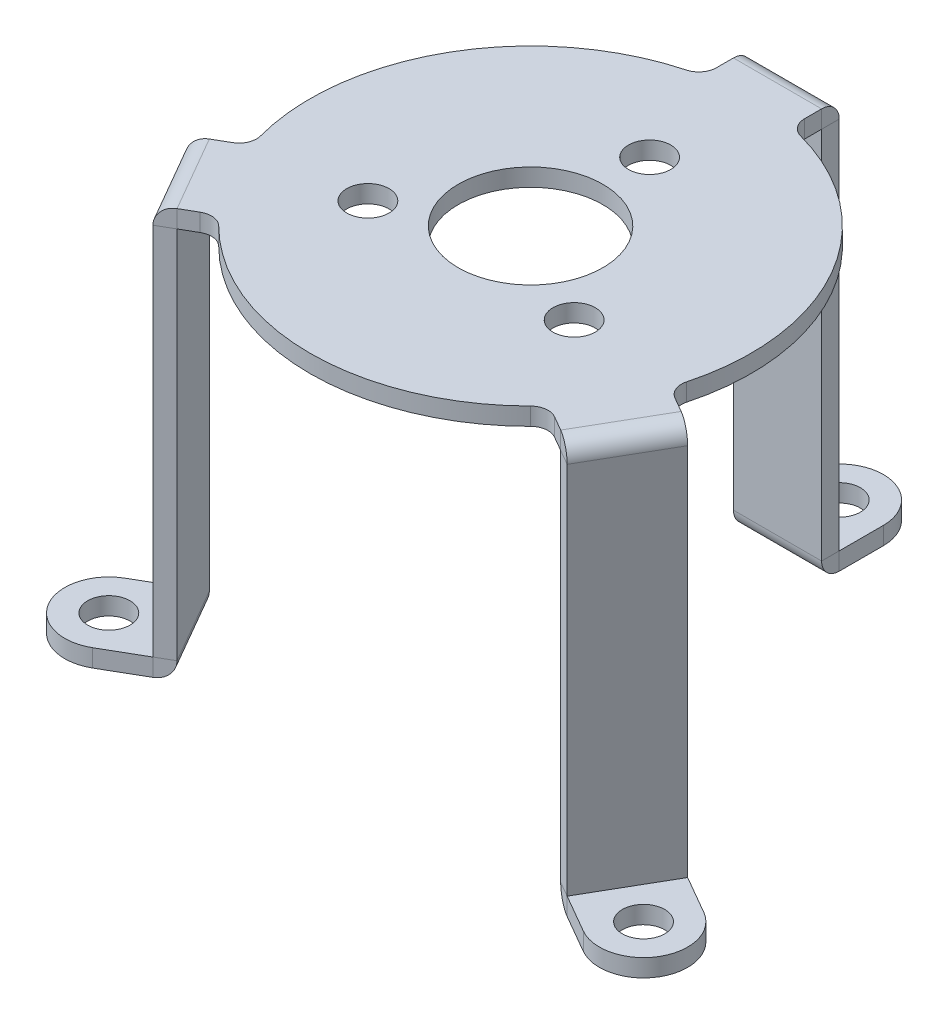
from build123d import *

# Parameters (mm, degrees)
ESBO_O1_R                  = 4.1
ESBO_O1_R_2                = 1.2
RESSALTO_EXTRUS_O1_DEPTH   = 1
ESBO_O2_W                  = 5
ESBO_O2_H                  = 1
RESSALTO_EXTRUS_O2_DEPTH   = 22.2
ESBO_O3_R                  = 1.2
RESSALTO_EXTRUS_O3_DEPTH   = 1
FILETE1_R                  = 1
CONVERT_SOLID4_OUTLINE_R   = 1.2
CONVERT_SOLID4_OUTLINE_R_2 = 4.1
CONVERT_SOLID4_DEPTH       = 1
CONVERT_SOLID4_START       = -21.2
CONVERT_SOLID4_2_OUTLINE_W = 5
CONVERT_SOLID4_2_OUTLINE_H = 1
CONVERT_SOLID4_2_DEPTH     = 21.2
CONVERT_SOLID4_START_2     = -2.5
CONVERT_SOLID4_3_DEPTH     = 5
CONVERT_SOLID4_4_DEPTH     = 4.999999999
CONVERT_SOLID4_5_DEPTH     = 5
CUT_EXTRUDE1_START         = -1
SKETCH18_R                 = 1.2
CUT_EXTRUDE1_DEPTH         = 1


with BuildPart() as part:
    # Esboço1 → Ressalto-extrusão1 (new body)
    with BuildSketch(Plane(origin=(0, 0, 0), x_dir=(1, 0, 0), z_dir=(0, 1, 0))):
        with BuildLine():
            Line((-2.5, 15), (-2.5, 12.247448714))
            ThreePointArc((-2.5, 12.247448714), (-10.825317547, 6.25), (-11.856601718, -3.958660847))
            Line((-11.856601718, -3.958660847), (-14.240381057, -5.334936491))
            Line((-14.240381057, -5.334936491), (-11.740381057, -9.665063509))
            Line((-11.740381057, -9.665063509), (-9.356601718, -8.288787866))
            ThreePointArc((-9.356601718, -8.288787866), (0, -12.5), (9.356601718, -8.288787866))
            Line((9.356601718, -8.288787866), (11.740381057, -9.665063509))
            Line((11.740381057, -9.665063509), (14.240381057, -5.334936491))
            Line((14.240381057, -5.334936491), (11.856601718, -3.958660847))
            ThreePointArc((11.856601718, -3.958660847), (10.825317547, 6.25), (2.5, 12.247448714))
            Line((2.5, 12.247448714), (2.5, 15))
            Line((2.5, 15), (-2.5, 15))
        make_face()
        with Locations(Location((0, 0, 0), (0, 0, 270))):
            Circle(ESBO_O1_R, mode=Mode.SUBTRACT)
        with Locations(Location((0, 6.75, 0), (0, 0, 270))):
            Circle(ESBO_O1_R_2, mode=Mode.SUBTRACT)
        with Locations(Location((5.845671476, -3.375, 0), (0, 0, 270))):
            Circle(ESBO_O1_R_2, mode=Mode.SUBTRACT)
        with Locations(Location((-5.845671476, -3.375, 0), (0, 0, 270))):
            Circle(ESBO_O1_R_2, mode=Mode.SUBTRACT)
    extrude(amount=RESSALTO_EXTRUS_O1_DEPTH)

    # Esboço2 → Ressalto-extrusão2 (add)
    with BuildSketch(Plane.XZ):
        with Locations((0, -14.5)):
            Rectangle(ESBO_O2_W, ESBO_O2_H)
        Polygon((-10.874355653, 9.165063509), (-11.740381057, 9.665063509), (-14.240381057, 5.334936491), (-13.374355653, 4.834936491), align=None)
        Polygon((13.374355653, 4.834936491), (14.240381057, 5.334936491), (11.740381057, 9.665063509), (10.874355653, 9.165063509), align=None)
    extrude(amount=RESSALTO_EXTRUS_O2_DEPTH)

    # Esboço3 → Ressalto-extrusão3 (add)
    # profile 1 of 3: a face of its own
    with BuildSketch(Plane.XZ.offset(22.2)):
        with BuildLine():
            Line((2.5, -15), (2.5, -17.5))
            ThreePointArc((2.5, -17.5), (0, -20), (-2.5, -17.5))
            Line((-2.5, -17.5), (-2.5, -15))
            Line((-2.5, -15), (2.5, -15))
        make_face()
        with Locations(Location((0, -17.5, 0), (0, 0, 270))):
            Circle(ESBO_O3_R, mode=Mode.SUBTRACT)
    # profile 2 of 3: a face of its own
    with BuildSketch(Plane.XZ.offset(22.2)):
        with BuildLine():
            Line((-11.740381057, 9.665063509), (-13.905444566, 10.915063509))
            ThreePointArc((-13.905444566, 10.915063509), (-17.320508076, 10), (-16.405444566, 6.584936491))
            Line((-16.405444566, 6.584936491), (-14.240381057, 5.334936491))
            Line((-14.240381057, 5.334936491), (-11.740381057, 9.665063509))
        make_face()
        with Locations(Location((-15.155444566, 8.75, 0), (0, 0, 270))):
            Circle(ESBO_O3_R, mode=Mode.SUBTRACT)
    # profile 3 of 3: a face of its own
    with BuildSketch(Plane.XZ.offset(22.2)):
        with BuildLine():
            Line((14.240381057, 5.334936491), (16.405444566, 6.584936491))
            ThreePointArc((16.405444566, 6.584936491), (17.320508076, 10), (13.905444566, 10.915063509))
            Line((13.905444566, 10.915063509), (11.740381057, 9.665063509))
            Line((11.740381057, 9.665063509), (14.240381057, 5.334936491))
        make_face()
        with Locations(Location((15.155444566, 8.75, 0), (0, 0, 270))):
            Circle(ESBO_O3_R, mode=Mode.SUBTRACT)
    extrude(amount=-RESSALTO_EXTRUS_O3_DEPTH)

    # Filete1
    filete1_edges = [part.edges().sort_by_distance(p)[0] for p in [
        (11.856601718, 0.5, 3.958660847),
        (2.5, 0.5, -12.247448714),
        (-2.5, 0.5, -12.247448714),
        (-11.856601718, 0.5, 3.958660847),
        (9.356601718, 0.5, 8.288787866),
        (-9.356601718, 0.5, 8.288787866),
    ]]
    fillet(filete1_edges, radius=FILETE1_R)


with BuildPart() as body_2:
    # Convert-Solid4: read off the stored shape, not the designer's step
    # Convert-Solid4 outline → Convert-Solid4 (new body)
    with BuildSketch(Plane(origin=(0, 0, 0), x_dir=(1, 0, 0), z_dir=(0, 1, 0))):
        with BuildLine():
            Line((2.5, 14), (-2.5, 14))
            Line((-2.5, 14), (-2.5, 13.03840481))
            ThreePointArc((-2.5, 13.03840481), (-2.706507952, 12.429824191), (-3.240740741, 12.072597047))
            ThreePointArc((-3.240740741, 12.072597047), (-10.825317547, 6.25), (-12.075546102, -3.229734715))
            ThreePointArc((-12.075546102, -3.229734715), (-12.11779749, -3.871007453), (-12.541589791, -4.354138896))
            Line((-12.541589791, -4.354138896), (-13.374355653, -4.834936491))
            Line((-13.374355653, -4.834936491), (-10.874355653, -9.165063509))
            Line((-10.874355653, -9.165063509), (-10.041589791, -8.684265915))
            ThreePointArc((-10.041589791, -8.684265915), (-9.411289538, -8.558816738), (-8.834805362, -8.842862332))
            ThreePointArc((-8.834805362, -8.842862332), (0, -12.5), (8.834805362, -8.842862332))
            ThreePointArc((8.834805362, -8.842862332), (9.411289538, -8.558816738), (10.041589791, -8.684265915))
            Line((10.041589791, -8.684265915), (10.874355653, -9.165063509))
            Line((10.874355653, -9.165063509), (13.374355653, -4.834936491))
            Line((13.374355653, -4.834936491), (12.541589791, -4.354138896))
            ThreePointArc((12.541589791, -4.354138896), (12.11779749, -3.871007453), (12.075546102, -3.229734715))
            ThreePointArc((12.075546102, -3.229734715), (10.825317547, 6.25), (3.240740741, 12.072597047))
            ThreePointArc((3.240740741, 12.072597047), (2.706507952, 12.429824191), (2.5, 13.03840481))
            Line((2.5, 13.03840481), (2.5, 14))
        make_face()
        with Locations((-5.845671476, -3.375)):
            Circle(CONVERT_SOLID4_OUTLINE_R, mode=Mode.SUBTRACT)
        Circle(CONVERT_SOLID4_OUTLINE_R_2, mode=Mode.SUBTRACT)
        with Locations((5.845671476, -3.375)):
            Circle(CONVERT_SOLID4_OUTLINE_R, mode=Mode.SUBTRACT)
        with Locations((0, 6.75)):
            Circle(CONVERT_SOLID4_OUTLINE_R, mode=Mode.SUBTRACT)
    extrude(amount=CONVERT_SOLID4_DEPTH)

    # Convert-Solid4 2 outline → Convert-Solid4 2 (add)
    with BuildSketch(Plane(origin=(0, 0, 0), x_dir=(1, 0, 0), z_dir=(0, 1, 0)).offset(CONVERT_SOLID4_START)):
        with Locations((0, 14.5)):
            Rectangle(CONVERT_SOLID4_2_OUTLINE_W, CONVERT_SOLID4_2_OUTLINE_H)
        Polygon((-10.874355653, -9.165063509), (-13.374355653, -4.834936491), (-14.240381057, -5.334936491), (-11.740381057, -9.665063509), align=None)
        Polygon((14.240381057, -5.334936491), (13.374355653, -4.834936491), (10.874355653, -9.165063509), (11.740381057, -9.665063509), align=None)
    extrude(amount=CONVERT_SOLID4_2_DEPTH)

    # Convert-Solid4 3 outline → Convert-Solid4 3 (add)
    with BuildSketch(Plane.YZ.offset(CONVERT_SOLID4_START_2)):
        with BuildLine():
            Line((0, -14), (0, -15))
            ThreePointArc((0, -15), (0.707106781, -14.707106781), (1, -14))
            Line((1, -14), (0, -14))
        make_face()
    extrude(amount=CONVERT_SOLID4_3_DEPTH)

    # Convert-Solid4 4 outline → Convert-Solid4 4 (add)
    with BuildSketch(Plane(origin=(0, 0, 0), x_dir=(0.866025403784438, 0, -0.500000000000001), z_dir=(0.500000000000001, 0, 0.866025403784438)).offset(CONVERT_SOLID4_START_2)):
        with BuildLine():
            ThreePointArc((-14, 1), (-14.707106781, 0.707106781), (-15, 0))
            Line((-15, 0), (-14, 0))
            Line((-14, 0), (-14, 1))
        make_face()
    extrude(amount=CONVERT_SOLID4_4_DEPTH)

    # Convert-Solid4 5 outline → Convert-Solid4 5 (add)
    with BuildSketch(Plane(origin=(0, 0, 0), x_dir=(0.8660254037844386, 0, 0.4999999999999999), z_dir=(0.4999999999999999, 0, -0.8660254037844388)).offset(CONVERT_SOLID4_START_2)):
        with BuildLine():
            ThreePointArc((14, -1), (14.707106781, -0.707106781), (15, 0))
            Line((15, 0), (14, 0))
            Line((14, 0), (14, -1))
        make_face()
    extrude(amount=CONVERT_SOLID4_5_DEPTH)

    # Edge-Flange1: read off the stored shape, not the designer's step
    # Edge-Flange1: loft between two sections, ruled curve by curve
    edge_flange1_from = [
        Edge.make_three_point_arc((-2.5, -21.2, -14), (-2.5, -21.907106781, -14.292893219), (-2.5, -22.2, -15)),
        Edge.make_line((-2.5, -22.2, -15), (-2.5, -22.2, -20)),
        Edge.make_line((-2.5, -21.2, -20), (-2.5, -21.2, -15)),
        Edge.make_line((-2.5, -21.2, -20), (-2.5, -22.2, -20)),
        Edge.make_line((-2.5, -21.2, -15), (-2.5, -21.2, -14)),
    ]
    edge_flange1_to = [
        Edge.make_three_point_arc((2.5, -21.2, -14), (2.5, -21.907106781, -14.292893219), (2.5, -22.2, -15)),
        Edge.make_line((2.5, -22.2, -15), (2.5, -22.2, -20)),
        Edge.make_line((2.5, -21.2, -20), (2.5, -21.2, -15)),
        Edge.make_line((2.5, -21.2, -20), (2.5, -22.2, -20)),
        Edge.make_line((2.5, -21.2, -15), (2.5, -21.2, -14)),
    ]
    edge_flange1 = Solid(Shell([*[Face.make_surface_from_curves(edge_flange1_from[k], edge_flange1_to[k]) for k in range(5)], Face(Wire(edge_flange1_from)), Face(Wire(edge_flange1_to))]))
    add(edge_flange1)

    # Edge-Flange1 2: loft between two sections, ruled curve by curve
    edge_flange1_2_from = [
        Edge.make_three_point_arc((-10.874355653, -21.2, 9.165063509), (-11.128008621, -21.907106781, 9.311510119), (-11.740381057, -22.2, 9.665063509)),
        Edge.make_line((-11.740381057, -22.2, 9.665063509), (-16.070508076, -22.2, 12.165063509)),
        Edge.make_line((-16.070508076, -21.2, 12.165063509), (-11.740381057, -21.2, 9.665063509)),
        Edge.make_line((-16.070508076, -21.2, 12.165063509), (-16.070508076, -22.2, 12.165063509)),
        Edge.make_line((-11.740381057, -21.2, 9.665063509), (-10.874355653, -21.2, 9.165063509)),
    ]
    edge_flange1_2_to = [
        Edge.make_three_point_arc((-13.374355653, -21.2, 4.834936491), (-13.628008621, -21.907106781, 4.9813831), (-14.240381057, -22.2, 5.334936491)),
        Edge.make_line((-14.240381057, -22.2, 5.334936491), (-18.570508076, -22.2, 7.834936491)),
        Edge.make_line((-18.570508076, -21.2, 7.834936491), (-14.240381057, -21.2, 5.334936491)),
        Edge.make_line((-18.570508076, -21.2, 7.834936491), (-18.570508076, -22.2, 7.834936491)),
        Edge.make_line((-14.240381057, -21.2, 5.334936491), (-13.374355653, -21.2, 4.834936491)),
    ]
    edge_flange1_2 = Solid(Shell([*[Face.make_surface_from_curves(edge_flange1_2_from[k], edge_flange1_2_to[k]) for k in range(5)], Face(Wire(edge_flange1_2_from)), Face(Wire(edge_flange1_2_to))]))
    add(edge_flange1_2)

    # Edge-Flange1 3: loft between two sections, ruled curve by curve
    edge_flange1_3_from = [
        Edge.make_three_point_arc((13.374355653, -21.2, 4.834936491), (13.628008621, -21.907106781, 4.9813831), (14.240381057, -22.2, 5.334936491)),
        Edge.make_line((18.570508076, -21.2, 7.834936491), (18.570508076, -22.2, 7.834936491)),
        Edge.make_line((14.240381057, -22.2, 5.334936491), (18.570508076, -22.2, 7.834936491)),
        Edge.make_line((18.570508076, -21.2, 7.834936491), (14.240381057, -21.2, 5.334936491)),
        Edge.make_line((14.240381057, -21.2, 5.334936491), (13.374355653, -21.2, 4.834936491)),
    ]
    edge_flange1_3_to = [
        Edge.make_three_point_arc((10.874355653, -21.2, 9.165063509), (11.128008621, -21.907106781, 9.311510119), (11.740381057, -22.2, 9.665063509)),
        Edge.make_line((16.070508076, -21.2, 12.165063509), (16.070508076, -22.2, 12.165063509)),
        Edge.make_line((11.740381057, -22.2, 9.665063509), (16.070508076, -22.2, 12.165063509)),
        Edge.make_line((16.070508076, -21.2, 12.165063509), (11.740381057, -21.2, 9.665063509)),
        Edge.make_line((11.740381057, -21.2, 9.665063509), (10.874355653, -21.2, 9.165063509)),
    ]
    edge_flange1_3 = Solid(Shell([*[Face.make_surface_from_curves(edge_flange1_3_from[k], edge_flange1_3_to[k]) for k in range(5)], Face(Wire(edge_flange1_3_from)), Face(Wire(edge_flange1_3_to))]))
    add(edge_flange1_3)

    # Sketch18 → Cut-Extrude1 (cut)
    with BuildSketch(Plane(origin=(0, -21.2, 0), x_dir=(1, 0, 0), z_dir=(0, 1, 0)).offset(CUT_EXTRUDE1_START)):
        with Locations(Location((-15.155444566, -8.75, 0), (0, 0, 180))):
            Circle(SKETCH18_R)
        with Locations(Location((0, 17.5, 0), (0, 0, 180))):
            Circle(SKETCH18_R)
        with Locations(Location((15.155444566, -8.75, 0), (0, 0, 180))):
            Circle(SKETCH18_R)
        with BuildLine():
            Line((-16.405444566, -6.584936491), (-16.905444566, -5.718911087))
            Line((-16.905444566, -5.718911087), (-19.936533479, -7.468911087))
            Line((-19.936533479, -7.468911087), (-16.436533479, -13.531088913))
            Line((-16.436533479, -13.531088913), (-13.405444566, -11.781088913))
            Line((-13.405444566, -11.781088913), (-13.905444566, -10.915063509))
            ThreePointArc((-13.905444566, -10.915063509), (-17.320508076, -10), (-16.405444566, -6.584936491))
        make_face()
        with BuildLine():
            Line((2.5, 17.5), (3.5, 17.5))
            Line((3.5, 17.5), (3.5, 21))
            Line((3.5, 21), (-3.5, 21))
            Line((-3.5, 21), (-3.5, 17.5))
            Line((-3.5, 17.5), (-2.5, 17.5))
            ThreePointArc((-2.5, 17.5), (0, 20), (2.5, 17.5))
        make_face()
        with BuildLine():
            Line((13.905444566, -10.915063509), (13.405444566, -11.781088913))
            Line((13.405444566, -11.781088913), (16.436533479, -13.531088913))
            Line((16.436533479, -13.531088913), (19.936533479, -7.468911087))
            Line((19.936533479, -7.468911087), (16.905444566, -5.718911087))
            Line((16.905444566, -5.718911087), (16.405444566, -6.584936491))
            ThreePointArc((16.405444566, -6.584936491), (17.320508076, -10), (13.905444566, -10.915063509))
        make_face()
    extrude(amount=CUT_EXTRUDE1_DEPTH, mode=Mode.SUBTRACT)


solid = body_2.part
